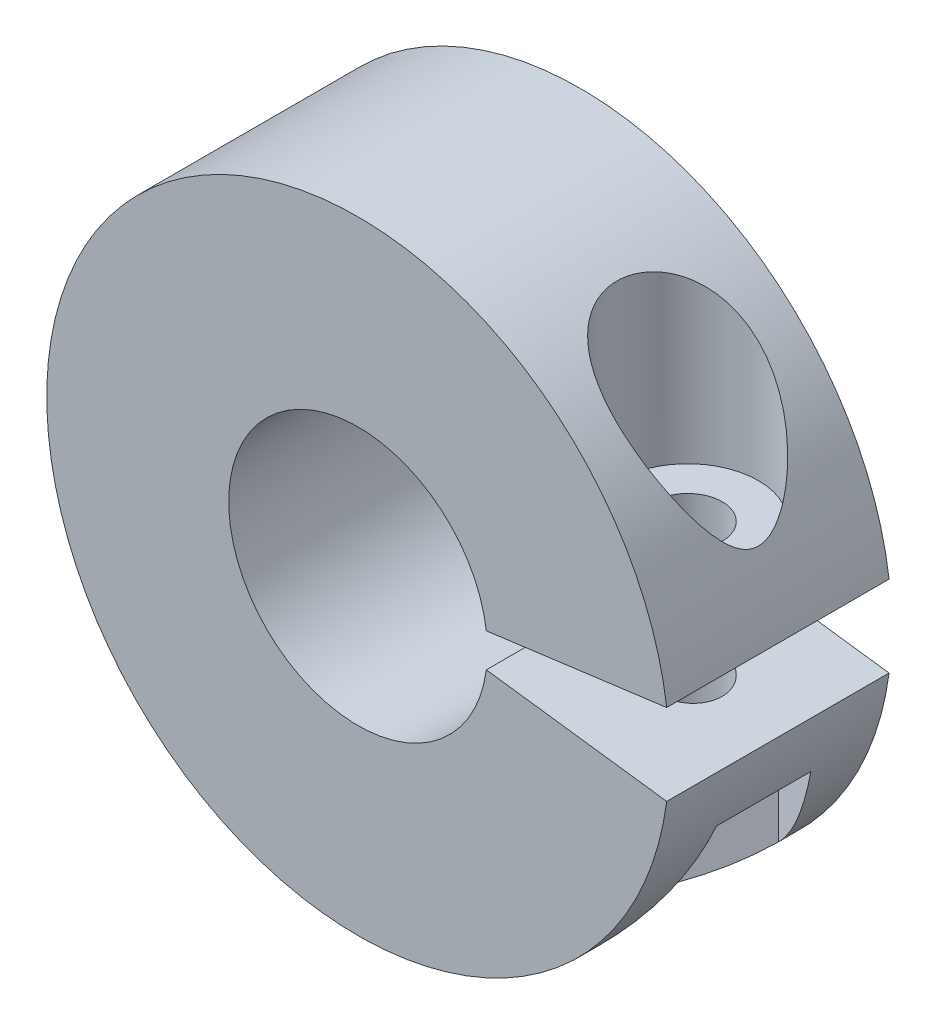
from build123d import *

# Parameters (mm, degrees)
BOSS_EXTRUDE1_DEPTH     = 11
CUT_EXTRUDE1_DEPTH      = 25.399180314
CUT_EXTRUDE1_DEPTH_BACK = 25.399180314
SKETCH3_R               = 1.7
CUT_EXTRUDE2_START      = 5
SKETCH3_3_R             = 3.5
SKETCH3_3_R_2           = 1.7
CUT_EXTRUDE2_DEPTH      = 20.399180485
CUT_EXTRUDE3_START      = -5
SKETCH3_5_R             = 1.7
CUT_EXTRUDE3_DEPTH      = 20.399180485


with BuildPart() as part:
    # Sketch1 → Boss-Extrude1 (new body)
    with BuildSketch(Plane.XY):
        with BuildLine():
            Line((6.345247113, 0.83536763), (15.268250865, 2.01010336))
            ThreePointArc((15.268250865, 2.01010336), (-15.4, 0), (15.268250865, -2.01010336))
            Line((15.268250865, -2.01010336), (6.345247113, -0.83536763))
            ThreePointArc((6.345247113, -0.83536763), (-6.4, 0), (6.345247113, 0.83536763))
        make_face()
    extrude(amount=BOSS_EXTRUDE1_DEPTH)

    # Sketch3 → Cut-Extrude1 (cut, two sides: drawn at the far end of the back side and taken through both)
    with BuildSketch(Plane(origin=(0, 0, 0), x_dir=(1, 0, 0), z_dir=(0, 1, 0)).offset(-CUT_EXTRUDE1_DEPTH_BACK)):
        with Locations((10.806748989, -5.5)):
            Circle(SKETCH3_R)
    extrude(amount=CUT_EXTRUDE1_DEPTH + CUT_EXTRUDE1_DEPTH_BACK, mode=Mode.SUBTRACT)

    # Sketch3<3> → Cut-Extrude2 (cut, through all)
    with BuildSketch(Plane(origin=(0, 0, 0), x_dir=(1, 0, 0), z_dir=(0, 1, 0)).offset(CUT_EXTRUDE2_START)):
        with Locations((10.806748989, -5.5)):
            Circle(SKETCH3_3_R)
        with Locations((10.806748989, -5.5)):
            Circle(SKETCH3_3_R_2, mode=Mode.SUBTRACT)
    extrude(amount=CUT_EXTRUDE2_DEPTH, mode=Mode.SUBTRACT)

    # Sketch3<5> → Cut-Extrude3 (cut, through all)
    with BuildSketch(Plane(origin=(0, 0, 0), x_dir=(1, 0, 0), z_dir=(0, 1, 0)).offset(CUT_EXTRUDE3_START)):
        Polygon((14.703863306, -3.25), (10.806748989, -1), (6.909634672, -3.25), (6.909634672, -7.75), (10.806748989, -10), (14.703863306, -7.75), align=None)
        with Locations((10.806748989, -5.5)):
            Circle(SKETCH3_5_R, mode=Mode.SUBTRACT)
    extrude(amount=-CUT_EXTRUDE3_DEPTH, mode=Mode.SUBTRACT)


solid = part.part
